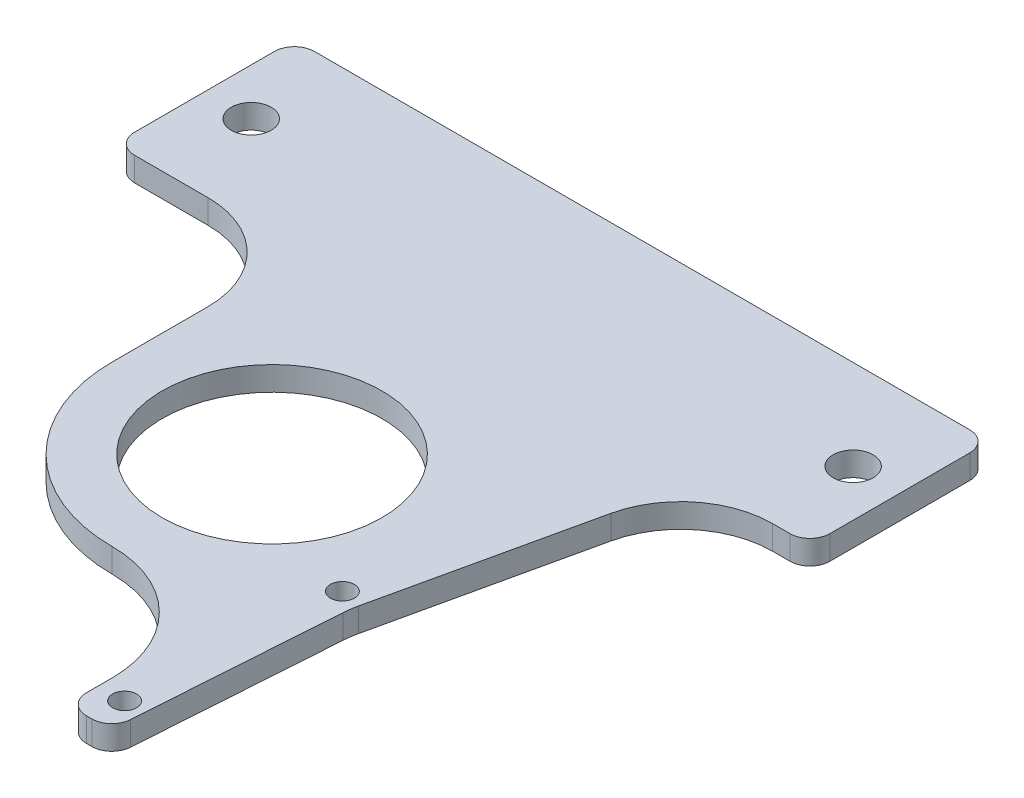
from build123d import *

# Parameters (mm, degrees)
SKETCH1_R           = 27.5
SKETCH1_R_2         = 3
SKETCH1_R_3         = 5
BOSS_EXTRUDE1_DEPTH = 6
FILLET1_R           = 5


with BuildPart() as part:
    # Sketch1 → Boss-Extrude1 (new body)
    with BuildSketch(Plane(origin=(0, 0, 0), x_dir=(1, 0, 0), z_dir=(0, 1, 0))):
        with BuildLine():
            Line((-86.99995828, 92.60002775), (86.99995828, 92.60002775))
            Line((86.99995828, 92.60002775), (86.99995828, 47.6))
            Line((86.99995828, 47.6), (77.649944321, 47.6))
            ThreePointArc((77.649944321, 47.6), (63.262449751, 42.544358445), (55.2, 29.6))
            Line((55.2, 29.6), (43.692619616, -22.06800978))
            ThreePointArc((43.692619616, -22.06800978), (43.380057159, -23.771301539), (43.196535229, -25.49328232))
            Line((43.196535229, -25.49328232), (39.782384757, -75.242332057))
            ThreePointArc((39.782384757, -75.242332057), (38.206473118, -78.554562921), (34.794117647, -79.9))
            Line((34.794117647, -79.9), (33.462740879, -79.9))
            ThreePointArc((33.462740879, -79.9), (29.927206973, -78.435533906), (28.462740879, -74.9))
            Line((28.462740879, -74.9), (28.462740879, -68.462740879))
            ThreePointArc((28.462740879, -68.462740879), (20.126197087, -48.336543792), (0, -40))
            ThreePointArc((0, -40), (-28.284271247, -28.284271247), (-40, 0))
            Line((-40, 0), (-40, 23.975365872))
            ThreePointArc((-40, 23.975365872), (-46.919495133, 40.680504867), (-63.624634128, 47.6))
            Line((-63.624634128, 47.6), (-86.99995828, 47.6))
            Line((-86.99995828, 47.6), (-86.99995828, 92.60002775))
        make_face()
        Circle(SKETCH1_R, mode=Mode.SUBTRACT)
        with Locations((38.5, -20.9)):
            Circle(SKETCH1_R_2, mode=Mode.SUBTRACT)
        with Locations((35, -71.9)):
            Circle(SKETCH1_R_2, mode=Mode.SUBTRACT)
        with Locations((-75.312296204, 70.100013875)):
            Circle(SKETCH1_R_3, mode=Mode.SUBTRACT)
        with Locations((75.312296204, 70.100013875)):
            Circle(SKETCH1_R_3, mode=Mode.SUBTRACT)
    extrude(amount=BOSS_EXTRUDE1_DEPTH)

    # Fillet1
    fillet1_edges = [part.edges().sort_by_distance(p)[0] for p in [
        (86.99995828, 3, -47.6),
        (86.99995828, 3, -92.60002775),
        (-86.99995828, 3, -92.60002775),
        (-86.99995828, 3, -47.6),
    ]]
    fillet(fillet1_edges, radius=FILLET1_R)


solid = part.part
